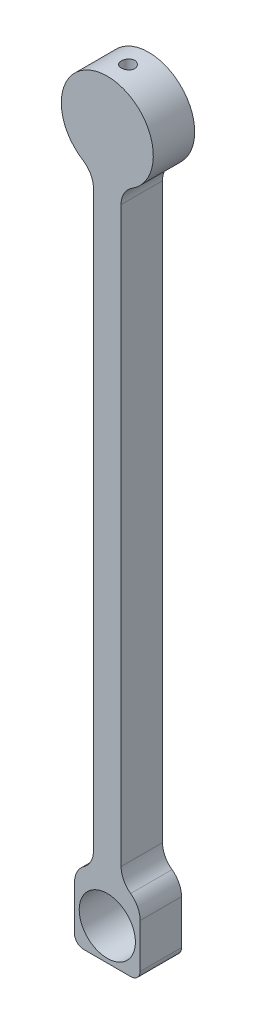
from build123d import *

# Parameters (mm, degrees)
SKETCH1_R               = 10
BOSS_EXTRUDE1_DEPTH     = 9
CUT_EXTRUDE1_DEPTH      = 10
SKETCH3_W               = 14.282856858
SKETCH3_H               = 9
BOSS_EXTRUDE2_DEPTH     = 150
SKETCH4_R               = 6.11
CUT_EXTRUDE2_DEPTH      = 10
FILLET1_R               = 5
FILLET2_R               = 2
CUT_EXTRUDE5_DEPTH      = 158.575378787
CUT_EXTRUDE5_DEPTH_BACK = 158.575378787
FILLET3_R               = 5
BOSS_EXTRUDE3_START     = -2
BOSS_EXTRUDE3_DEPTH     = 2
SKETCH10_R              = 1.45
CUT_EXTRUDE6_DEPTH      = 10


with BuildPart() as part:
    # Sketch1 → Boss-Extrude1 (new body)
    with BuildSketch(Plane.XY):
        Circle(SKETCH1_R)
        with BuildLine():
            ThreePointArc((1.862913214, 2.723885893), (0, -3.3), (-1.862913214, 2.723885893))
            Line((-1.862913214, 2.723885893), (1.862913214, 2.723885893))
        make_face(mode=Mode.SUBTRACT)
    extrude(amount=BOSS_EXTRUDE1_DEPTH)

    # Sketch2 → Cut-Extrude1 (cut)
    with BuildSketch(Plane(origin=(0, 0, 0), x_dir=(-1, 0, 0), z_dir=(0, 0, -1))):
        with BuildLine():
            Line((7.141428429, -7), (-7.141428429, -7))
            ThreePointArc((-7.141428429, -7), (-3.872983346, -9.219544457), (0, -10))
            ThreePointArc((0, -10), (3.872983346, -9.219544457), (7.141428429, -7))
        make_face()
    extrude(amount=-CUT_EXTRUDE1_DEPTH, mode=Mode.SUBTRACT)

    # Sketch3 → Boss-Extrude2 (add)
    with BuildSketch(Plane.XZ.offset(7)):
        with Locations((0, 4.5)):
            Rectangle(SKETCH3_W, SKETCH3_H)
    extrude(amount=BOSS_EXTRUDE2_DEPTH)

    # Sketch4 → Cut-Extrude2 (cut)
    with BuildSketch(Plane(origin=(0, 0, 0), x_dir=(-1, 0, 0), z_dir=(0, 0, -1))):
        with Locations((0, -150)):
            Circle(SKETCH4_R)
    extrude(amount=-CUT_EXTRUDE2_DEPTH, mode=Mode.SUBTRACT)

    # Fillet1
    fillet1_edges = [part.edges().sort_by_distance(p)[0] for p in [
        (-7.141428429, -7, 4.5),
        (7.141428429, -7, 4.5),
    ]]
    fillet(fillet1_edges, radius=FILLET1_R)

    # Fillet2
    fillet2_edges = [part.edges().sort_by_distance(p)[0] for p in [
        (7.141428429, -157, 4.5),
        (-7.141428429, -157, 4.5),
    ]]
    fillet(fillet2_edges, radius=FILLET2_R)

    # Sketch8 → Cut-Extrude5 (cut, two sides: drawn at the far end of the back side and taken through both)
    with BuildSketch(Plane(origin=(0, 0, 0), x_dir=(-1, 0, 0), z_dir=(0, 0, -1)).offset(-CUT_EXTRUDE5_DEPTH_BACK)):
        with BuildLine():
            Line((-3, -137.31142246), (-3, -12.68857754))
            ThreePointArc((-3, -12.68857754), (-3.622024821, -10.273348083), (-5.333333333, -8.459051694))
            ThreePointArc((-5.333333333, -8.459051694), (-6.837266216, -7.297382455), (-8.094285619, -5.872183607))
            ThreePointArc((-8.094285619, -5.872183607), (-7.385604943, -7.264856163), (-7.141428429, -8.808275411))
            Line((-7.141428429, -8.808275411), (-7.141428429, -143))
            ThreePointArc((-7.141428429, -143), (-6.279898742, -142.217784905), (-5.333333333, -141.540948306))
            ThreePointArc((-5.333333333, -141.540948306), (-3.622024821, -139.726651917), (-3, -137.31142246))
        make_face()
        with BuildLine():
            ThreePointArc((7.141428429, -8.808275411), (7.385604943, -7.264856163), (8.094285619, -5.872183607))
            ThreePointArc((8.094285619, -5.872183607), (6.837266216, -7.297382455), (5.333333333, -8.459051694))
            ThreePointArc((5.333333333, -8.459051694), (3.622024821, -10.273348083), (3, -12.68857754))
            Line((3, -12.68857754), (3, -137.31142246))
            ThreePointArc((3, -137.31142246), (3.622024821, -139.726651917), (5.333333333, -141.540948306))
            ThreePointArc((5.333333333, -141.540948306), (6.279898742, -142.217784905), (7.141428429, -143))
            Line((7.141428429, -143), (7.141428429, -8.808275411))
        make_face()
    extrude(amount=CUT_EXTRUDE5_DEPTH + CUT_EXTRUDE5_DEPTH_BACK, mode=Mode.SUBTRACT)

    # Fillet3
    fillet3_edges = [part.edges().sort_by_distance(p)[0] for p in [
        (-7.141428429, -143, 4.5),
        (7.141428429, -143, 4.5),
    ]]
    fillet(fillet3_edges, radius=FILLET3_R)

    # Sketch9 → Boss-Extrude3 (add)
    with BuildSketch(Plane.XY.offset(9).offset(BOSS_EXTRUDE3_START)):
        with BuildLine():
            Line((-1.862913214, 2.723885893), (1.862913214, 2.723885893))
            ThreePointArc((1.862913214, 2.723885893), (0, -3.3), (-1.862913214, 2.723885893))
        make_face()
    extrude(amount=BOSS_EXTRUDE3_DEPTH)

    # Sketch10 → Cut-Extrude6 (cut)
    with BuildSketch(Plane(origin=(0, 10, 0), x_dir=(1, 0, 0), z_dir=(0, 1, 0))):
        with Locations((0, -4.5)):
            Circle(SKETCH10_R)
    extrude(amount=-CUT_EXTRUDE6_DEPTH, mode=Mode.SUBTRACT)


solid = part.part
